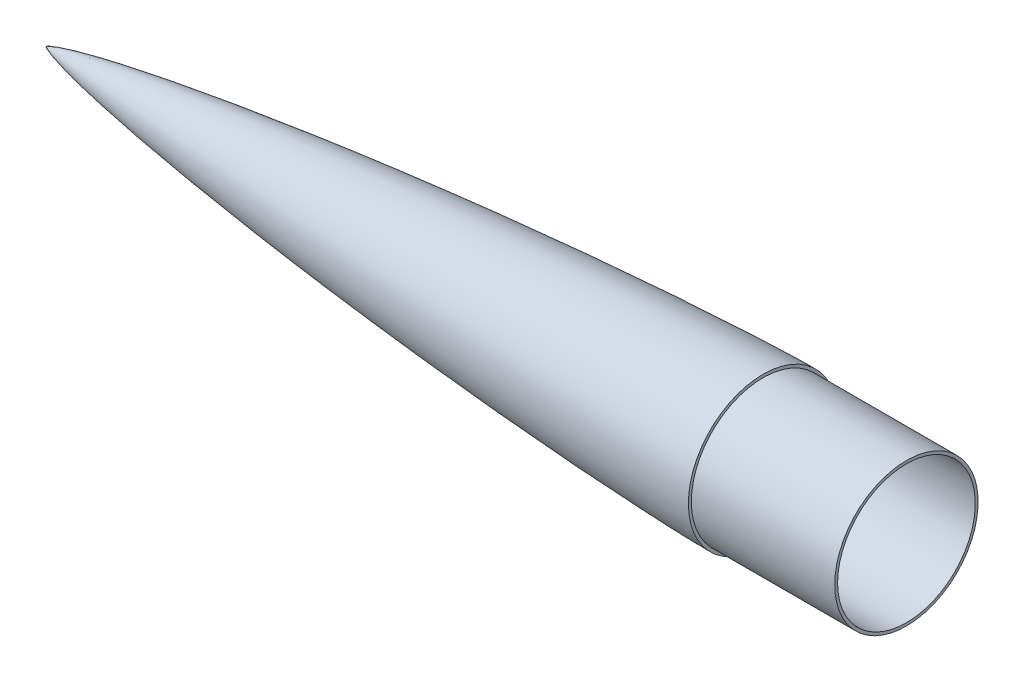
from build123d import *


with BuildPart() as part:
    # Sketch1 → Revolve1 (revolve)
    with BuildSketch(Plane.XY):
        with BuildLine():
            Line((0, 0), (381, 0))
            Line((381, 0), (381, 36.576))
            Line((381, 36.576), (457.2, 36.576))
            Line((457.2, 36.576), (457.2, 38.1))
            Line((457.2, 38.1), (381, 38.1))
            Line((381, 38.1), (381, 39.6748))
            add(Edge.make_bspline(
                [(0, 0), (0.003049784, 0.007391517), (0.010516248, 0.021348199), (0.031106971, 0.045829707), (0.065584271, 0.078798932), (0.108492279, 0.114236913), (0.16958222, 0.159319643), (0.242948898, 0.208369014), (0.353595607, 0.276354909), (0.521636885, 0.369995093), (0.771175836, 0.496239018), (1.180403122, 0.683204498), (1.86846602, 0.965449012), (3.099394532, 1.412949551), (5.366955001, 2.134635712), (9.58844178, 3.296682882), (16.872911503, 5.018684969), (29.364107414, 7.563668892), (46.572164331, 10.574876522), (67.50309145, 13.802490117), (90.908289905, 17.033151185), (114.349996323, 19.984267529), (137.819727011, 22.703156758), (161.311837549, 25.220271357), (184.822932751, 27.553353436), (208.350495811, 29.713623185), (231.892861419, 31.706176933), (255.44876977, 33.531630389), (279.017374196, 35.185409988), (302.598081581, 36.657133991), (323.241506393, 37.768650037), (340.94316852, 38.573934104), (355.171608915, 39.104818498), (364.711499732, 39.393596186), (372.512915975, 39.573617216), (377.362499083, 39.647950618), (379.787469508, 39.671705044), (381, 39.6748)],
                knots=[0, 0, 0, 0, 0, 8.2804e-05, 0.000165607, 0.000331214, 0.000496821, 0.000662428, 0.000956602, 0.001250775, 0.001849959, 0.002666859, 0.003870456, 0.005938925, 0.009599104, 0.016314131, 0.028665592, 0.051563135, 0.087598694, 0.149159504, 0.210720313, 0.272281124, 0.333841937, 0.39540275, 0.456963563, 0.518524376, 0.580085188, 0.641646, 0.703206813, 0.764767626, 0.826328439, 0.887889252, 0.918669658, 0.949450065, 0.974725032, 0.987362516, 1, 1, 1, 1, 1], degree=4))
        make_face()
    revolve(axis=Axis((-22.86, 0, 0), (1, 0, 0)))


solid = part.part
